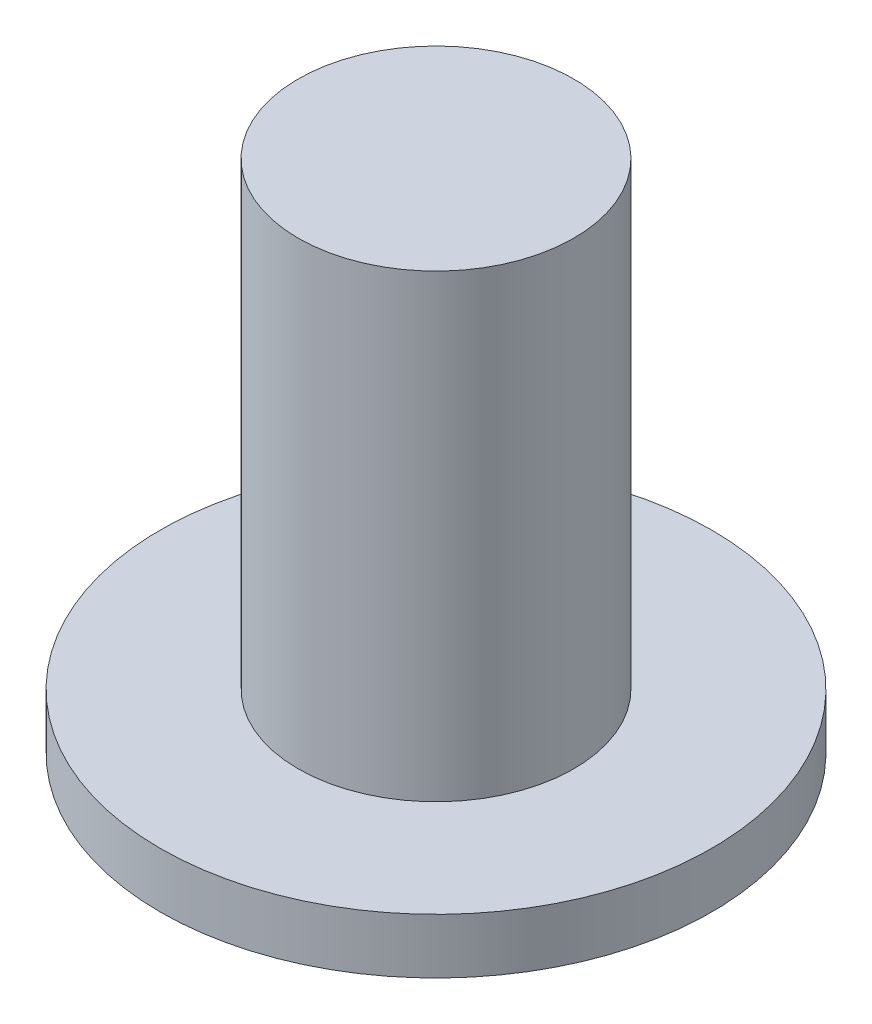
from build123d import *

# Parameters (mm, degrees)
SKETCH2_R           = 150
BOSS_EXTRUDE1_DEPTH = 30
SKETCH3_R           = 75
BOSS_EXTRUDE2_DEPTH = 250


with BuildPart() as part:
    # Sketch2 → Boss-Extrude1 (new body)
    with BuildSketch(Plane(origin=(0, 0, 0), x_dir=(1, 0, 0), z_dir=(0, 1, 0))):
        Circle(SKETCH2_R)
    extrude(amount=BOSS_EXTRUDE1_DEPTH)

    # Sketch3 → Boss-Extrude2 (add)
    with BuildSketch(Plane(origin=(0, 30, 0), x_dir=(1, 0, 0), z_dir=(0, 1, 0))):
        Circle(SKETCH3_R)
    extrude(amount=BOSS_EXTRUDE2_DEPTH)


solid = part.part
